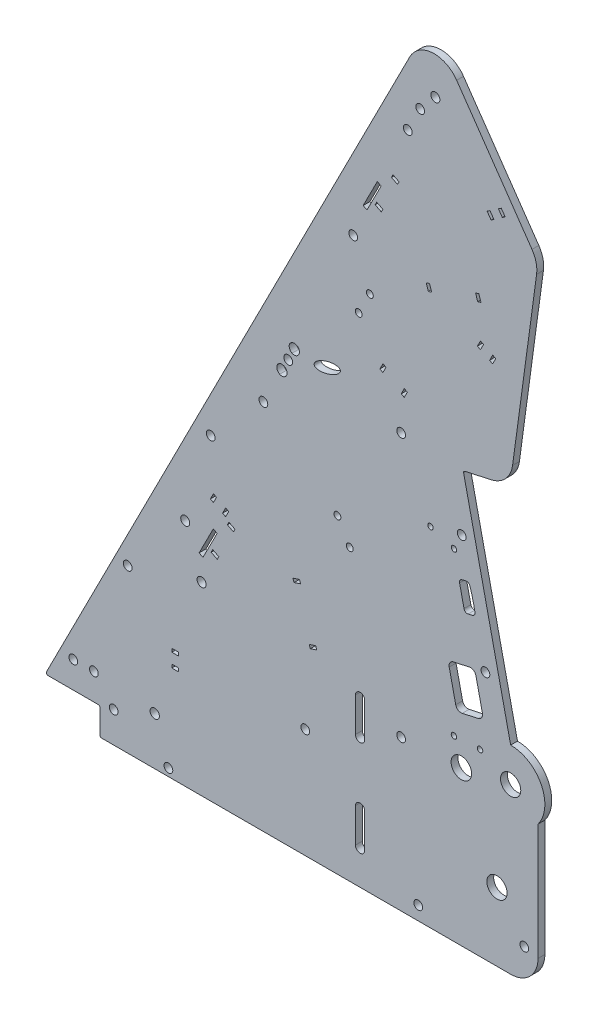
from build123d import *

# Parameters (mm, degrees)
BOSS_EXTRUDE1_DEPTH     = 3.175
SKETCH2_R               = 2.0955
SKETCH2_R_2             = 2.032
SKETCH2_R_3             = 4.699
CUT_EXTRUDE1_DEPTH      = 421.976111717
SKETCH7_R               = 2.159
CUT_EXTRUDE2_DEPTH      = 421.976111717
CUT_EXTRUDE3_REACH      = 422.976
SKETCH10_R              = 2.032
FILLET1_R               = 12.7
FILLET2_R               = 0.79375
SKETCH12_R              = 2.032
CUT_EXTRUDE5_DEPTH      = 411.989226146
CUT_EXTRUDE6_DEPTH      = 411.989226146
CUT_EXTRUDE6_DEPTH_BACK = 411.989226146
SKETCH13_R              = 1.27
SKETCH14_R              = 2.032
SKETCH14_R_2            = 1.6
SKETCH14_RX             = 6.35
SKETCH14_RY             = 2.38125
SKETCH14_W              = 3.175
SKETCH14_H              = 1.5875
CUT_EXTRUDE7_DEPTH      = 411.989226146
SKETCH15_R              = 2.032
CUT_EXTRUDE8_DEPTH      = 411.989226285
FILLET3_R               = 2.54
SKETCH16_R              = 4.7625
CUT_EXTRUDE9_DEPTH      = 411.989226285


with BuildPart() as part:
    # Sketch1 → Boss-Extrude1 (new body)
    with BuildSketch(Plane.XY):
        with BuildLine():
            Line((228.6, -12.7), (228.6, 53.975))
            ThreePointArc((228.6, 53.975), (230.099031657, 70.599515829), (215.9, 79.375))
            Line((215.9, 79.375), (193.909735224, 178.566674323))
            Line((193.909735224, 178.566674323), (215.607913982, 183.377044743))
            Line((215.607913982, 183.377044743), (228.6, 279.4))
            Line((228.6, 279.4), (178.754725958, 351.413083686))
            Line((178.754725958, 351.413083686), (0, 0))
            Line((0, 0), (25.4, 0))
            Line((25.4, 0), (25.4, -12.7))
            Line((25.4, -12.7), (228.6, -12.7))
        make_face()
    extrude(amount=BOSS_EXTRUDE1_DEPTH)

    # Sketch2 → Cut-Extrude1 (cut, through all)
    with BuildSketch(Plane.XY.offset(3.175)):
        with Locations((64.943150167, 94.057839899)):
            Circle(SKETCH2_R)
        with Locations((180.975, 322.164313376)):
            Circle(SKETCH2_R)
        with Locations((72.544547852, 73.173171402)):
            Circle(SKETCH2_R)
        with Locations((193.207821773, 152.394364194)):
            Circle(SKETCH2_R_2)
        with Locations((215.9, 63.5)):
            Circle(SKETCH2_R_3)
        with Locations((173.0375, -6.35)):
            Circle(SKETCH2_R_2)
        with Locations((204.202954161, 102.798527032)):
            Circle(SKETCH2_R_2)
        with Locations((209.55, 19.05)):
            Circle(SKETCH2_R_3)
        with Locations((165.1, 179.3875)):
            Circle(SKETCH2_R_2)
    extrude(amount=-CUT_EXTRUDE1_DEPTH, mode=Mode.SUBTRACT)

    # Sketch7 → Cut-Extrude2 (cut, through all)
    with BuildSketch(Plane.XY.offset(3.175)):
        with Locations((50.8, 9.525)):
            Circle(SKETCH7_R)
        with BuildLine():
            Line((143.891, 3.175), (143.891, 19.05))
            ThreePointArc((143.891, 19.05), (146.05, 21.209), (148.209, 19.05))
            Line((148.209, 19.05), (148.209, 3.175))
            ThreePointArc((148.209, 3.175), (146.05, 1.016), (143.891, 3.175))
        make_face()
        with BuildLine():
            Line((143.891, 47.625), (143.891, 63.5))
            ThreePointArc((143.891, 63.5), (146.05, 65.659), (148.209, 63.5))
            Line((148.209, 63.5), (148.209, 47.625))
            ThreePointArc((148.209, 47.625), (146.05, 45.466), (143.891, 47.625))
        make_face()
    extrude(amount=-CUT_EXTRUDE2_DEPTH, mode=Mode.SUBTRACT)

    # Sketch10 → Cut-Extrude3 (cut, up to next)
    with BuildSketch(Plane.XY.offset(3.175), mode=Mode.PRIVATE) as cut_extrude3_sk1:
        with Locations((165.1, 57.15)):
            Circle(SKETCH10_R)
    cut_extrude3_tool1 = extrude(cut_extrude3_sk1.sketch, amount=-CUT_EXTRUDE3_REACH, mode=Mode.PRIVATE) & part.part
    # Sketch10 → Cut-Extrude3 (cut, up to next)
    with BuildSketch(Plane.XY.offset(3.175), mode=Mode.PRIVATE) as cut_extrude3_sk2:
        with Locations((120.65, 38.1)):
            Circle(SKETCH10_R)
    cut_extrude3_tool2 = extrude(cut_extrude3_sk2.sketch, amount=-CUT_EXTRUDE3_REACH, mode=Mode.PRIVATE) & part.part
    # Sketch10 → Cut-Extrude3 (cut, up to next)
    with BuildSketch(Plane.XY.offset(3.175), mode=Mode.PRIVATE) as cut_extrude3_sk3:
        with Locations((13.046467246, 12.334704411)):
            Circle(SKETCH10_R)
    cut_extrude3_tool3 = extrude(cut_extrude3_sk3.sketch, amount=-CUT_EXTRUDE3_REACH, mode=Mode.PRIVATE) & part.part
    # Sketch10 → Cut-Extrude3 (cut, up to next)
    with BuildSketch(Plane.XY.offset(3.175), mode=Mode.PRIVATE) as cut_extrude3_sk4:
        with Locations((22.571467246, 12.334704411)):
            Circle(SKETCH10_R)
    cut_extrude3_tool4 = extrude(cut_extrude3_sk4.sketch, amount=-CUT_EXTRUDE3_REACH, mode=Mode.PRIVATE) & part.part
    # Sketch10 → Cut-Extrude3 (cut, up to next)
    with BuildSketch(Plane.XY.offset(3.175), mode=Mode.PRIVATE) as cut_extrude3_sk5:
        with Locations((38.261106384, 62.614550934)):
            Circle(SKETCH10_R)
    cut_extrude3_tool5 = extrude(cut_extrude3_sk5.sketch, amount=-CUT_EXTRUDE3_REACH, mode=Mode.PRIVATE) & part.part
    add(cut_extrude3_tool1.solids().sort_by_distance((165.1, 57.15, 3.175))[0], mode=Mode.SUBTRACT)
    add(cut_extrude3_tool2.solids().sort_by_distance((120.65, 38.1, 3.175))[0], mode=Mode.SUBTRACT)
    add(cut_extrude3_tool3.solids().sort_by_distance((13.046467, 12.334704, 3.175))[0], mode=Mode.SUBTRACT)
    add(cut_extrude3_tool4.solids().sort_by_distance((22.571467, 12.334704, 3.175))[0], mode=Mode.SUBTRACT)
    add(cut_extrude3_tool5.solids().sort_by_distance((38.261106, 62.614551, 3.175))[0], mode=Mode.SUBTRACT)

    # Fillet1
    fillet1_edges = [part.edges().sort_by_distance(p)[0] for p in [
        (228.6, -12.7, 1.5875),
        (178.754725958, 351.413083686, 1.5875),
        (215.607913982, 183.377044743, 1.5875),
        (228.6, 279.4, 1.5875),
    ]]
    fillet(fillet1_edges, radius=FILLET1_R)

    # Fillet2
    fillet2_edges = [part.edges().sort_by_distance(p)[0] for p in [
        (25.4, -12.7, 1.5875),
        (25.4, 0, 1.5875),
        (193.909735224, 178.566674323, 1.5875),
        (0, 0, 1.5875),
    ]]
    fillet(fillet2_edges, radius=FILLET2_R)

    # Sketch12 → Cut-Extrude5 (cut, through all)
    with BuildSketch(Plane.XY.offset(3.175)):
        with Locations((31.75, 1.5875)):
            Circle(SKETCH12_R)
        with Locations((222.25, 1.5875)):
            Circle(SKETCH12_R)
        with Locations((57.15, -9.2075)):
            Circle(SKETCH12_R)
    extrude(amount=-CUT_EXTRUDE5_DEPTH, mode=Mode.SUBTRACT)

    # Sketch13 → Cut-Extrude6 (cut, two sides: drawn at the far end of the back side and taken through both)
    with BuildSketch(Plane.XY.offset(3.175).offset(-CUT_EXTRUDE6_DEPTH_BACK)):
        with Locations((189.602197334, 69.980636704)):
            Circle(SKETCH13_R)
        with Locations((201.708862449, 70.509225118)):
            Circle(SKETCH13_R)
        with Locations((178.721644858, 148.532438598)):
            Circle(SKETCH13_R)
        with Locations((189.622629605, 145.09537131)):
            Circle(SKETCH13_R)
        Polygon((186.844411154, 98.950230697), (199.243370445, 101.699013794), (203.36654509, 83.100574858), (190.9675858, 80.351791761), align=None)
        with BuildLine():
            Line((195.12807169, 134.933592333), (193.415301921, 134.553880417))
            ThreePointArc((193.415301921, 134.553880417), (192.420015888, 133.856973634), (192.209029897, 132.660412618))
            Line((192.209029897, 132.660412618), (194.270617219, 123.36119315))
            ThreePointArc((194.270617219, 123.36119315), (194.967524002, 122.365907117), (196.164085018, 122.154921126))
            Line((196.164085018, 122.154921126), (198.109091879, 122.586118766))
            ThreePointArc((198.109091879, 122.586118766), (199.082720469, 123.249946547), (199.330550026, 124.401988414))
            ThreePointArc((199.330550026, 124.401988414), (198.332361402, 129.18494451), (196.979617949, 133.879956193))
            ThreePointArc((196.979617949, 133.879956193), (196.256822614, 134.763465498), (195.12807169, 134.933592333))
        make_face()
    extrude(amount=CUT_EXTRUDE6_DEPTH + CUT_EXTRUDE6_DEPTH_BACK, mode=Mode.SUBTRACT)

    # Sketch14 → Cut-Extrude7 (cut, through all)
    with BuildSketch(Plane.XY.offset(3.175)):
        with Locations((142.875, 247.65)):
            Circle(SKETCH14_R)
        with Locations((112.7125, 182.5625)):
            Circle(SKETCH14_R)
        with Locations((101.196445848, 159.923142748)):
            Circle(SKETCH14_R)
        with Locations((150.594024053, 227.898538502)):
            Circle(SKETCH14_R_2)
        with Locations((145.425401324, 217.737567137)):
            Circle(SKETCH14_R_2)
        with Locations((135.545743513, 131.358540309)):
            Circle(SKETCH14_R_2)
        with Locations((141.245743513, 121.485850706)):
            Circle(SKETCH14_R_2)
        with Locations(Location((130.826142263, 188.461522288), (0, 0, -161.961260538))):
            Ellipse(SKETCH14_RX, SKETCH14_RY)
        Polygon((147.482742003, 261.9243054), (154.04689287, 274.828739034), (155.829519425, 273.921963116), (149.265368558, 261.017529483), align=None)
        Polygon((160.590482388, 279.78010172), (161.310235773, 281.195061549), (164.140155429, 279.75555478), (163.420402045, 278.340594951), align=None)
        Polygon((153.789663007, 266.410402556), (156.619582664, 264.970895787), (155.899829279, 263.555935959), (153.069909623, 264.995442728), align=None)
        Polygon((178.26972852, 245.992253978), (179.240391581, 242.969268992), (177.728899089, 242.483937462), (176.758236028, 245.506922447), align=None)
        Polygon((200.609634347, 249.830809719), (199.638971286, 252.853794704), (201.150463779, 253.339126235), (202.12112684, 250.316141249), align=None)
        Polygon((77.953373051, 97.225512031), (79.735999607, 96.318736114), (73.17184874, 83.41430248), (71.389222185, 84.321078398), align=None)
        Polygon((85.216715955, 103.591834546), (84.49696257, 102.176874718), (87.326882227, 100.737367949), (88.046635611, 102.152327777), align=None)
        Polygon((156.643043941, 199.39992488), (158.08255071, 202.229844536), (156.667590882, 202.949597921), (155.228084113, 200.119678264), align=None)
        Polygon((165.132802911, 195.081404573), (166.57230968, 197.911324229), (167.987269508, 197.191570845), (166.547762739, 194.361651188), align=None)
        Polygon((77.696143189, 88.807175554), (76.976389805, 87.392215725), (79.806309461, 85.952708956), (80.526062846, 87.367668785), align=None)
        Polygon((201.915382504, 234.74968075), (200.475875735, 231.919761094), (201.890835563, 231.200007709), (203.330342332, 234.029927366), align=None)
        Polygon((206.135715047, 229.040747556), (207.575221816, 231.870667212), (208.990181645, 231.150913828), (207.550674876, 228.320994171), align=None)
        Polygon((205.013971437, 288.371538288), (206.820969573, 285.760909487), (208.126283974, 286.664408555), (206.319285837, 289.275037356), align=None)
        Polygon((210.235229039, 291.98553456), (212.042227175, 289.374905759), (213.347541575, 290.278404827), (211.540543439, 292.889033628), align=None)
        Polygon((122.453385221, 73.10367975), (122.951215646, 71.596257739), (125.966059667, 72.591918589), (125.468229242, 74.099340599), align=None)
        Polygon((114.917306673, 95.922796693), (115.415137097, 94.415374682), (118.429981119, 95.411035531), (117.932150694, 96.918457542), align=None)
        with Locations((60.325, 38.89375)):
            Rectangle(SKETCH14_W, SKETCH14_H)
        with Locations((60.325, 32.54375)):
            Rectangle(SKETCH14_W, SKETCH14_H)
        Polygon((78.051560814, 111.424204195), (76.612054045, 108.594284538), (78.027013874, 107.874531154), (79.466520643, 110.70445081), align=None)
        Polygon((82.271893358, 105.715271), (83.711400127, 108.545190657), (85.126359956, 107.825437272), (83.686853187, 104.995517616), align=None)
        with BuildLine():
            add(Edge.make_bspline(
                [(108.753856385, 174.780220945), (110.821723963, 173.728350313), (111.90135404, 175.850790056), (112.980984117, 177.973229798), (110.913116539, 179.025100429)],
                knots=[0, 0, 0, 1.570796327, 1.570796327, 3.141592654, 3.141592654, 3.141592654], degree=2, weights=[1, 0.707106781, 1, 0.707106781, 1]))
            add(Edge.make_bspline(
                [(110.913116539, 179.025100429), (110.77268373, 179.096534959), (110.626511301, 179.154391231), (110.322493118, 179.242488117), (110.165373026, 179.272144601), (109.695542578, 179.315227584), (109.373415846, 179.283109915), (108.9218002, 179.145618276), (108.77365547, 179.084104344), (108.495402792, 178.934315945), (108.365007933, 178.846412483), (108.121928357, 178.644218756), (108.0096946, 178.529696631), (107.813416216, 178.283892413), (107.727754596, 178.151249117), (107.58342172, 177.86715543), (107.526957985, 177.720181494), (107.444132542, 177.416788403), (107.417775942, 177.25846019), (107.397765558, 176.943245973), (107.403605499, 176.786285249), (107.446503964, 176.473637327), (107.48413539, 176.317513381), (107.58741463, 176.020451076), (107.653173274, 175.877669132), (107.813265642, 175.6037409), (107.906595752, 175.474826714), (108.217757093, 175.120973916), (108.473611136, 174.922774438), (108.753856385, 174.780220945)],
                knots=[0, 0, 0, 0, 0.0625, 0.0625, 0.125, 0.125, 0.25, 0.25, 0.3125, 0.3125, 0.375, 0.375, 0.4375, 0.4375, 0.5, 0.5, 0.5625, 0.5625, 0.625, 0.625, 0.6875, 0.6875, 0.75, 0.75, 0.8125, 0.8125, 0.875, 0.875, 1, 1, 1, 1], degree=3))
        make_face()
        with BuildLine():
            add(Edge.make_bspline(
                [(114.511883461, 186.099899571), (116.579751039, 185.048028939), (117.659381116, 187.170468682), (118.739011193, 189.292908424), (116.671143615, 190.344779055)],
                knots=[0, 0, 0, 1.570796327, 1.570796327, 3.141592654, 3.141592654, 3.141592654], degree=2, weights=[1, 0.707106781, 1, 0.707106781, 1]))
            add(Edge.make_bspline(
                [(114.511883461, 186.099899571), (114.371072576, 186.171526418), (114.235866303, 186.257351722), (113.987547839, 186.450065421), (113.872855617, 186.557654504), (113.558328181, 186.915480737), (113.397407635, 187.190062471), (113.24126374, 187.640077887), (113.204646123, 187.792957095), (113.161785412, 188.104373095), (113.155794463, 188.264784445), (113.176022459, 188.579744294), (113.201753482, 188.734678369), (113.28477823, 189.039401247), (113.342554455, 189.189068059), (113.556262174, 189.609540487), (113.758638915, 189.862727621), (114.121215939, 190.164706401), (114.254157477, 190.254446578), (114.53236698, 190.404090785), (114.677524715, 190.464472802), (114.97978581, 190.556739169), (115.136913319, 190.588175808), (115.449881014, 190.619878989), (115.607376248, 190.620744977), (115.924438129, 190.591785045), (116.079517328, 190.562319108), (116.3815103, 190.475083726), (116.53003913, 190.416555249), (116.671143615, 190.344779055)],
                knots=[0, 0, 0, 0, 0.0625, 0.0625, 0.125, 0.125, 0.25, 0.25, 0.3125, 0.3125, 0.375, 0.375, 0.4375, 0.4375, 0.5, 0.5, 0.625, 0.625, 0.6875, 0.6875, 0.75, 0.75, 0.8125, 0.8125, 0.875, 0.875, 0.9375, 0.9375, 1, 1, 1, 1], degree=3))
        make_face()
    extrude(amount=-CUT_EXTRUDE7_DEPTH, mode=Mode.SUBTRACT)

    # Sketch15 → Cut-Extrude8 (cut, through all)
    with BuildSketch(Plane.XY.offset(3.175)):
        with Locations((76.786819993, 134.148053636)):
            Circle(SKETCH15_R)
        with Locations((173.947223848, 313.950707072)):
            Circle(SKETCH15_R)
        with Locations((168.189196772, 302.631028446)):
            Circle(SKETCH15_R)
    extrude(amount=-CUT_EXTRUDE8_DEPTH, mode=Mode.SUBTRACT)

    # Fillet3
    fillet3_edges = [part.edges().sort_by_distance(p)[0] for p in [
        (199.243370445, 101.699013794, 1.5875),
        (186.844411154, 98.950230697, 1.5875),
        (190.9675858, 80.351791761, 1.5875),
        (203.36654509, 83.100574858, 1.5875),
    ]]
    fillet(fillet3_edges, radius=FILLET3_R)

    # Sketch16 → Cut-Extrude9 (cut, through all)
    with BuildSketch(Plane.XY.offset(3.175)):
        with Locations((193.04, 58.801)):
            Circle(SKETCH16_R)
    extrude(amount=-CUT_EXTRUDE9_DEPTH, mode=Mode.SUBTRACT)


solid = part.part
